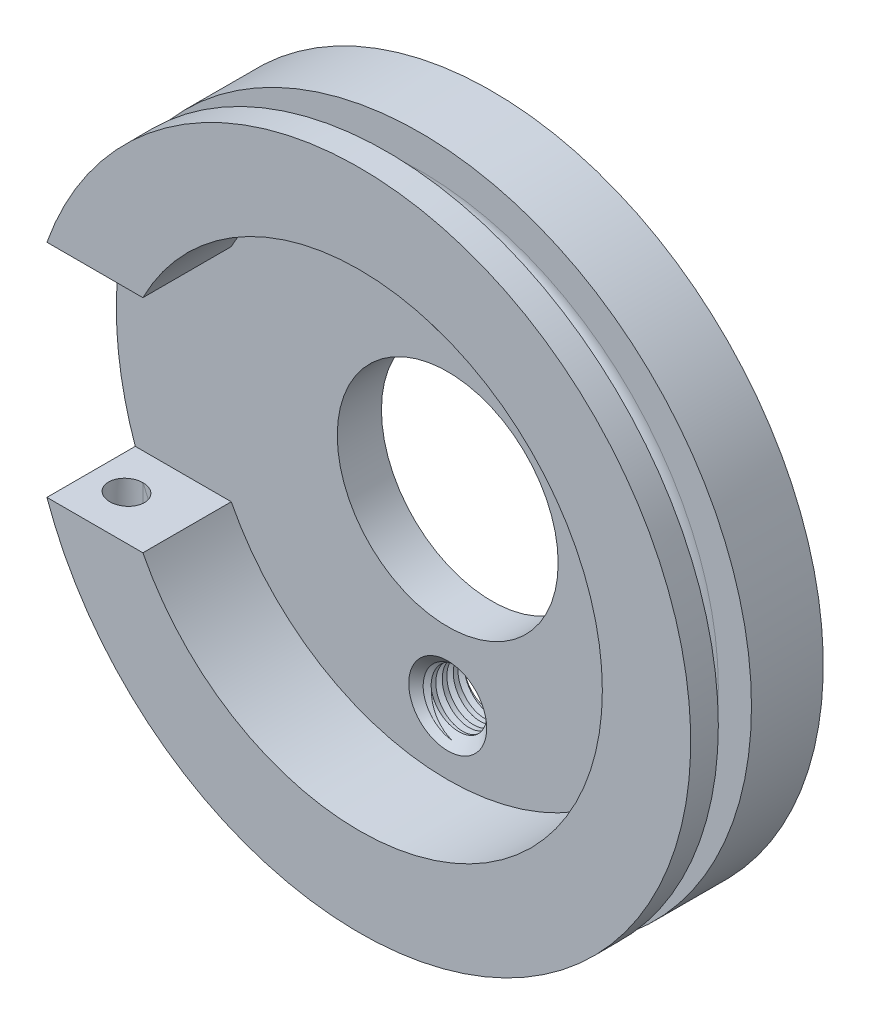
from build123d import *
from build123d.topology import SkipClean

# Parameters (mm, degrees)
SKETCH1_R           = 11
SKETCH1_R_2         = 5
BOSS_EXTRUDE1_DEPTH = 2
SKETCH3_R           = 15
SKETCH3_R_2         = 11
BOSS_EXTRUDE2_DEPTH = 6
SKETCH7_R           = 1.264824
CUT_EXTRUDE2_DEPTH  = 22.587033
CUT_EXTRUDE4_REACH  = 24.045
SKETCH8_W           = 11
SKETCH8_H           = 10
BOSS_EXTRUDE3_DEPTH = 5
CUT_EXTRUDE6_DEPTH  = 22.738503
CHAMFER1_SIZE       = 0.5
CUT_SWEEP1_PITCH    = 0.5
CHAMFER2_SIZE       = 0.5
CUT_SWEEP2_PITCH    = 0.5


with BuildPart() as part:
    # Sketch1 → Boss-Extrude1 (new body)
    with BuildSketch(Plane.XY):
        Circle(SKETCH1_R)
        Circle(SKETCH1_R_2, mode=Mode.SUBTRACT)
    extrude(amount=BOSS_EXTRUDE1_DEPTH)

    # Sketch3 → Boss-Extrude2 (add)
    with BuildSketch(Plane(origin=(0, 0, 0), x_dir=(-1, 0, 0), z_dir=(0, 0, -1))):
        Circle(SKETCH3_R)
        Circle(SKETCH3_R_2, mode=Mode.SUBTRACT)
    extrude(amount=-BOSS_EXTRUDE2_DEPTH)

    # Sketch7 → Cut-Extrude2 (cut, through all)
    with BuildSketch(Plane.XY.offset(2)):
        with Locations((0, 8.1)):
            Circle(SKETCH7_R)
        with Locations(Location((0, -8.1, 0), (0, 0, 180))):
            Circle(SKETCH7_R)
    extrude(amount=-CUT_EXTRUDE2_DEPTH, mode=Mode.SUBTRACT)

    # Sketch12 → Cut-Revolve2 (revolve, cut)
    with BuildSketch(Plane(origin=(0, 0, 0), x_dir=(1, 0, 0), z_dir=(0, 1, 0))):
        with BuildLine():
            Line((-13.5, -4.75), (-15, -4.75))
            Line((-15, -4.75), (-15, -3.25))
            Line((-15, -3.25), (-13.5, -3.25))
            ThreePointArc((-13.5, -3.25), (-12.75, -4), (-13.5, -4.75))
        make_face()
    revolve(axis=Axis((0, 0, 0), (0, 0, 1)), mode=Mode.SUBTRACT)

    # Cut-Extrude4: up to this face of the body (flat: up to its plane)
    cut_extrude4_end = Plane(part.part.faces().sort_by_distance((10.688873, 0, 2))[0])
    # Sketch8 → Cut-Extrude4 (cut, up to the picked face)
    with BuildSketch(Plane.XY.offset(6), mode=Mode.PRIVATE) as cut_extrude4_sk1:
        with Locations((-15, 0)):
            Rectangle(SKETCH8_W, SKETCH8_H)
    cut_extrude4_tool1 = split(extrude(cut_extrude4_sk1.sketch, amount=-CUT_EXTRUDE4_REACH, mode=Mode.PRIVATE), bisect_by=cut_extrude4_end, keep=Keep.BOTH, mode=Mode.PRIVATE)
    add(cut_extrude4_tool1.solids().sort_by(Axis((-15, 0, 6), (0, 0, -1)))[0], mode=Mode.SUBTRACT)

    # Sketch13 → Boss-Extrude3 (add)
    with BuildSketch(Plane(origin=(0, -5, 0), x_dir=(1, 0, 0), z_dir=(0, 1, 0))):
        with BuildLine():
            add(Edge.make_bspline(
                [(-12.539936, -4.75), (-12.743316, -4.75), (-12.94932, -4.675459), (-13.177132, -4.473427), (-13.240787, -4.390052), (-13.327362, -4.20596), (-13.350961, -4.104048), (-13.351373, -3.898723), (-13.328244, -3.796576), (-13.241567, -3.610961), (-13.178169, -3.527679), (-12.949651, -3.324465), (-12.744152, -3.25), (-12.539936, -3.25)],
                knots=[0, 0, 0, 0, 0.25, 0.25, 0.375, 0.375, 0.5, 0.5, 0.625, 0.625, 0.75, 0.75, 1, 1, 1, 1], degree=3))
            Line((-12.539936, -3.25), (-14.142136, -3.25))
            Line((-14.142136, -3.25), (-14.142136, -4.75))
            Line((-14.142136, -4.75), (-12.539936, -4.75))
        make_face()
    boss_extrude3 = extrude(amount=-BOSS_EXTRUDE3_DEPTH)

    # Sketch15 → Cut-Extrude6 (cut, through all)
    with SkipClean():  # the faces are left unmerged after this step: merging them gives an invalid solid
        with BuildSketch(Plane.XY.offset(4.75)):
            with BuildLine():
                Line((-14.142136, -5), (-14.142136, -10))
                Line((-14.142136, -10), (-12.539936, -10))
                Line((-12.539936, -10), (-12.539936, -8.231039))
                ThreePointArc((-12.539936, -8.231039), (-13.438495, -6.663847), (-14.142136, -5))
            make_face()
        cut_extrude6 = extrude(amount=-CUT_EXTRUDE6_DEPTH, mode=Mode.SUBTRACT)

    # Mirror2: Boss-Extrude3, Cut-Extrude6 across plane
    with SkipClean():  # the faces are left unmerged after this step: merging them gives an invalid solid
        add(boss_extrude3.mirror(Plane.ZX))
        add(cut_extrude6.mirror(Plane.ZX), mode=Mode.SUBTRACT)

    # Chamfer1
    chamfer1_edges = [part.edges().sort_by_distance(p)[0] for p in [
        (1.264824, -8.1, 2),
    ]]
    chamfer(chamfer1_edges, length=CHAMFER1_SIZE)

    # Cut-Sweep1: arcs per turn and ends read off the stored shape
    # Cut-Sweep1: the profile of Sketch17 screwed along a right-hand helix through 10 turns, 6 arcs to a turn; built about Z, then put on its axis
    with SkipClean():  # the faces are left unmerged after this step: merging them gives an invalid solid
        cut_sweep1_z = Axis((0, 0, 0), (0, 0, 1))
        cut_sweep1_corners = [(1.514824, 0, 0), (1.139824, 0, -0.216506), (1.139824, 0, 0.216506)]
        with BuildLine(mode=Mode.PRIVATE) as cut_sweep1_profile:
            Line(cut_sweep1_corners[0], cut_sweep1_corners[1])
            Line(cut_sweep1_corners[1], cut_sweep1_corners[2])
            Line(cut_sweep1_corners[2], cut_sweep1_corners[0])
        cut_sweep1_cap = Face(cut_sweep1_profile.wire())
        cut_sweep1_turn_angles = [0, 30, 60, 90, 120, 150, 180, 210, 240, 270, 300, 330, 360]
        cut_sweep1_turn_weights = [1, 0.8660254037844387, 1, 0.8660254037844387, 1, 0.8660254037844387, 1, 0.8660254037844387, 1, 0.8660254037844387, 1, 0.8660254037844387, 1]
        cut_sweep1_turn_rails = [Edge.make_bspline([Vector(p[0], p[1], 0).rotate(cut_sweep1_z, cut_sweep1_turn_angles[k]) / cut_sweep1_turn_weights[k] + Vector(0, 0, p[2] + CUT_SWEEP1_PITCH * cut_sweep1_turn_angles[k] / 360) for k in range(13)], [0, 0, 0, 1, 1, 2, 2, 3, 3, 4, 4, 5, 5, 6, 6, 6], 2, cut_sweep1_turn_weights) for p in cut_sweep1_corners]
        cut_sweep1_turn_sides = [Face.make_surface_from_curves(cut_sweep1_turn_rails[p[0]], cut_sweep1_turn_rails[p[1]]) for p in [(0, 1), (1, 2), (2, 0)]]
        cut_sweep1 = Plane(origin=(0, -8.1, 2), x_dir=(0, 1, 0), z_dir=(0, 0, -1)) * Solid(Shell([*[p.moved(Location((0, 0, CUT_SWEEP1_PITCH * i))) for i in range(10) for p in cut_sweep1_turn_sides], cut_sweep1_cap, cut_sweep1_cap.rotate(cut_sweep1_z, 3600).moved(Location((0, 0, CUT_SWEEP1_PITCH * 3600 / 360)))]))
        add(cut_sweep1, mode=Mode.SUBTRACT)

    # Chamfer2
    chamfer2_edges = [part.edges().sort_by_distance(p)[0] for p in [
        (-1.264824, 8.1, 2),
    ]]
    chamfer(chamfer2_edges, length=CHAMFER2_SIZE)

    # Cut-Sweep2: arcs per turn and ends read off the stored shape
    # Cut-Sweep2: the profile of Sketch19 screwed along a right-hand helix through 11 turns, 6 arcs to a turn; built about Z, then put on its axis
    with SkipClean():  # the faces are left unmerged after this step: merging them gives an invalid solid
        cut_sweep2_z = Axis((0, 0, 0), (0, 0, 1))
        cut_sweep2_corners = [(1.514824, 0, -0.5), (1.139824, 0, -0.716506), (1.139824, 0, -0.283494)]
        with BuildLine(mode=Mode.PRIVATE) as cut_sweep2_profile:
            Line(cut_sweep2_corners[0], cut_sweep2_corners[1])
            Line(cut_sweep2_corners[1], cut_sweep2_corners[2])
            Line(cut_sweep2_corners[2], cut_sweep2_corners[0])
        cut_sweep2_cap = Face(cut_sweep2_profile.wire())
        cut_sweep2_turn_angles = [0, 30, 60, 90, 120, 150, 180, 210, 240, 270, 300, 330, 360]
        cut_sweep2_turn_weights = [1, 0.8660254037844387, 1, 0.8660254037844387, 1, 0.8660254037844387, 1, 0.8660254037844387, 1, 0.8660254037844387, 1, 0.8660254037844387, 1]
        cut_sweep2_turn_rails = [Edge.make_bspline([Vector(p[0], p[1], 0).rotate(cut_sweep2_z, cut_sweep2_turn_angles[k]) / cut_sweep2_turn_weights[k] + Vector(0, 0, p[2] + CUT_SWEEP2_PITCH * cut_sweep2_turn_angles[k] / 360) for k in range(13)], [0, 0, 0, 1, 1, 2, 2, 3, 3, 4, 4, 5, 5, 6, 6, 6], 2, cut_sweep2_turn_weights) for p in cut_sweep2_corners]
        cut_sweep2_turn_sides = [Face.make_surface_from_curves(cut_sweep2_turn_rails[p[0]], cut_sweep2_turn_rails[p[1]]) for p in [(0, 1), (1, 2), (2, 0)]]
        cut_sweep2 = Plane(origin=(0, 8.1, 2), x_dir=(0, 1, 0), z_dir=(0, 0, -1)) * Solid(Shell([*[p.moved(Location((0, 0, CUT_SWEEP2_PITCH * i))) for i in range(11) for p in cut_sweep2_turn_sides], cut_sweep2_cap, cut_sweep2_cap.rotate(cut_sweep2_z, 3960).moved(Location((0, 0, CUT_SWEEP2_PITCH * 3960 / 360)))]))
        add(cut_sweep2, mode=Mode.SUBTRACT)


solid = part.part
